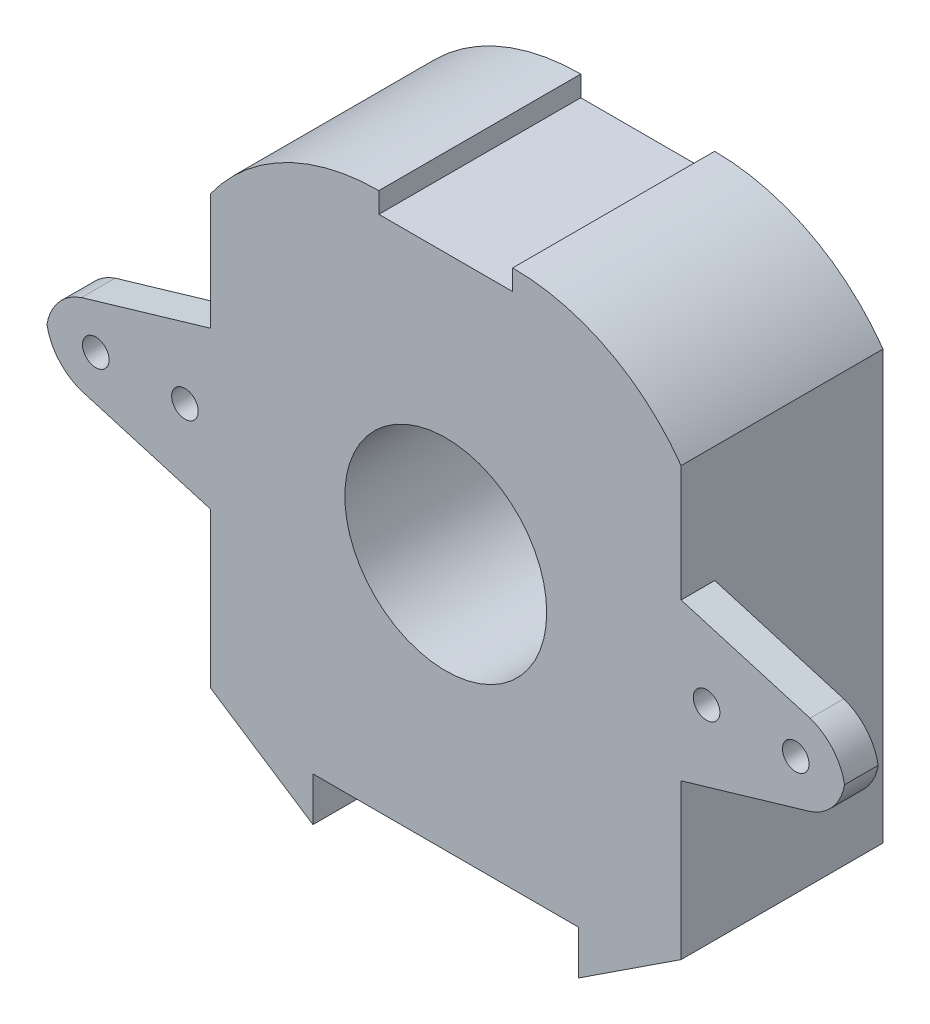
from build123d import *

# Parameters (mm, degrees)
BOSS_EXTRUDE2_DEPTH     = 15.24
SKETCH5_R               = 7.62
CUT_EXTRUDE2_DEPTH      = 15.24
BOSS_EXTRUDE3_DEPTH     = 2.54
CUT_EXTRUDE5_DEPTH      = 41.652633663
CUT_EXTRUDE5_DEPTH_BACK = 41.652633663
SKETCH7_R               = 1.0033


with BuildPart() as part:
    # Sketch1 → Boss-Extrude2 (new body)
    with BuildSketch(Plane.XY):
        with BuildLine():
            Line((-17.763499893, 14.683044609), (-17.763499893, -17.608986031))
            Line((-17.763499893, -17.608986031), (-10.024087591, -22.679635471))
            Line((-10.024087591, -22.679635471), (-10.024087591, -19.359490178))
            Line((-10.024087591, -19.359490178), (10.024087591, -19.359490178))
            Line((10.024087591, -19.359490178), (10.024087591, -22.679635471))
            Line((10.024087591, -22.679635471), (17.763499893, -17.608986031))
            Line((17.763499893, -17.608986031), (17.763499893, 14.683044609))
            ThreePointArc((17.763499893, 14.683044609), (12.2054587, 19.511759091), (5.051122326, 21.250660037))
            Line((5.051122326, 21.250660037), (5.051122326, 19.699745061))
            Line((5.051122326, 19.699745061), (-5.051122326, 19.699745061))
            Line((-5.051122326, 19.699745061), (-5.051122326, 21.250660037))
            ThreePointArc((-5.051122326, 21.250660037), (-12.2054587, 19.511759091), (-17.763499893, 14.683044609))
        make_face()
    extrude(amount=BOSS_EXTRUDE2_DEPTH)

    # Sketch5 → Cut-Extrude2 (cut)
    with BuildSketch(Plane.XY.offset(15.24)):
        Circle(SKETCH5_R)
    extrude(amount=-CUT_EXTRUDE2_DEPTH, mode=Mode.SUBTRACT)

    # Sketch6 → Boss-Extrude3 (add)
    with BuildSketch(Plane.XY.offset(15.24)):
        with BuildLine():
            Line((-27.497120647, 3.03730764), (-17.763499893, 5.900096548))
            Line((-17.763499893, 5.900096548), (-17.763499893, -5.920973667))
            Line((-17.763499893, -5.920973667), (-27.497120647, -3.058184758))
            ThreePointArc((-27.497120647, -3.058184758), (-29.216566103, -1.891287663), (-30.10005247, -0.010438559))
            ThreePointArc((-30.10005247, -0.010438559), (-29.216566103, 1.870410544), (-27.497120647, 3.03730764))
        make_face()
        with BuildLine():
            Line((27.497120647, 3.03730764), (17.763499893, 5.900096548))
            Line((17.763499893, 5.900096548), (17.763499893, -5.920973667))
            Line((17.763499893, -5.920973667), (27.497120647, -3.058184758))
            ThreePointArc((27.497120647, -3.058184758), (29.216566103, -1.891287663), (30.10005247, -0.010438559))
            ThreePointArc((30.10005247, -0.010438559), (29.216566103, 1.870410544), (27.497120647, 3.03730764))
        make_face()
    extrude(amount=-BOSS_EXTRUDE3_DEPTH)

    # Sketch7 → Cut-Extrude5 (cut, two sides: drawn at the far end of the back side and taken through both)
    with BuildSketch(Plane(origin=(0, 0, 0), x_dir=(-1, 0, 0), z_dir=(0, 0, -1)).offset(-CUT_EXTRUDE5_DEPTH_BACK)):
        with Locations((-19.685, 0)):
            Circle(SKETCH7_R)
        with Locations((-26.416, 0)):
            Circle(SKETCH7_R)
        with Locations((19.685, 0)):
            Circle(SKETCH7_R)
        with Locations((26.416, 0)):
            Circle(SKETCH7_R)
    extrude(amount=CUT_EXTRUDE5_DEPTH + CUT_EXTRUDE5_DEPTH_BACK, mode=Mode.SUBTRACT)


solid = part.part
